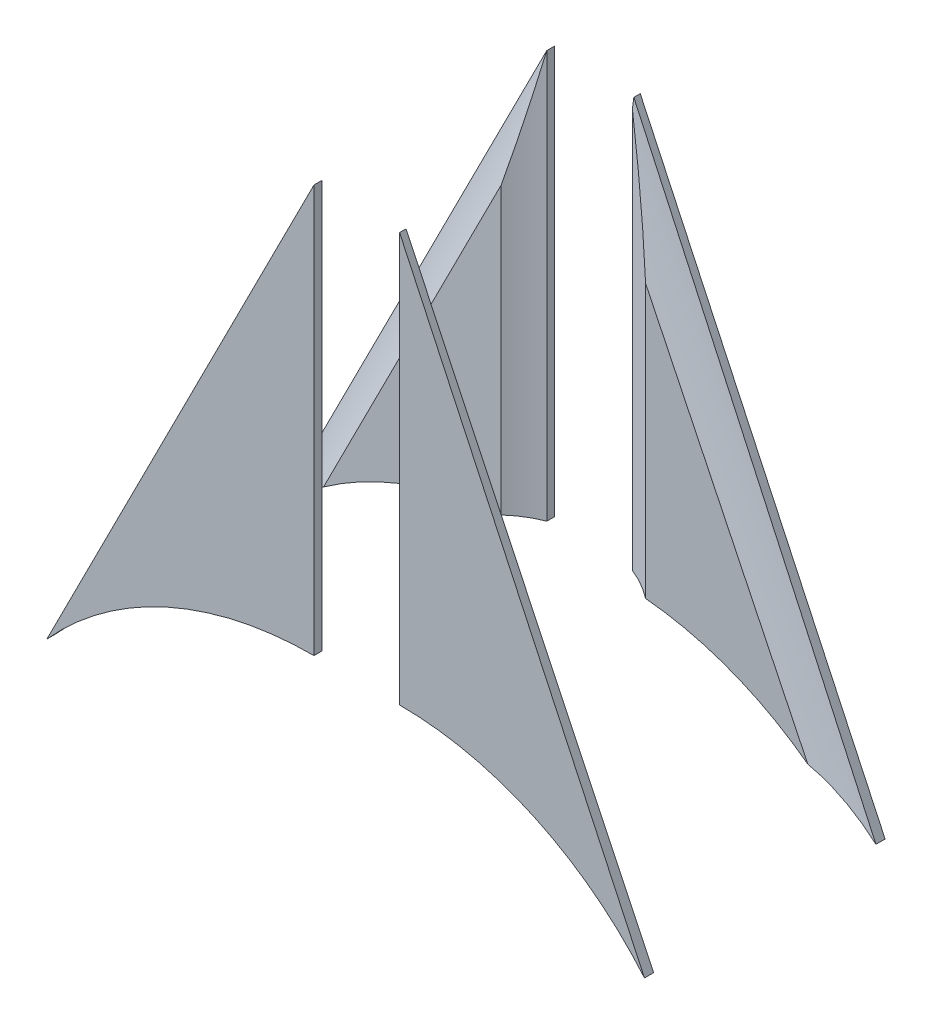
from build123d import *

# Parameters (mm, degrees)
BOSS_EXTRUDE1_DEPTH   = 1.5875
BOSS_EXTRUDE1_2_DEPTH = 1.5875
CUT_SWEEP1_PROFILE_R  = 7.9375
CUT_SWEEP2_START      = -23.066232356
CUT_SWEEP2_DEPTH      = 38.09827597
CUT_SWEEP3_PROFILE_R  = 7.9375


# Read off the part's stored shape, not the designer's step: Cut-Sweep2
with BuildPart() as part:
    # Sketch3 → Boss-Extrude1 (new body)
    with BuildSketch(Plane.XY.offset(6.35)):
        with BuildLine():
            Line((-20.444314967, -7.866681121), (-2.822222222, 26.887811152))
            Line((-2.822222222, 26.887811152), (-2.822222222, 0))
            ThreePointArc((-2.822222222, 0), (-12.471352035, -2.055956199), (-20.444314967, -7.866681121))
        make_face()
    extrude(amount=BOSS_EXTRUDE1_DEPTH)


with BuildPart() as body_2:
    # Sketch3 → Boss-Extrude1 2 (new body)
    with BuildSketch(Plane.XY.offset(6.35)):
        with BuildLine():
            Line((2.822222222, 0), (2.822222222, 26.989428429))
            Line((2.822222222, 26.989428429), (18.976219439, -7.518023406))
            ThreePointArc((18.976219439, -7.518023406), (11.731098442, -1.97155403), (2.822222222, 0))
        make_face()
    extrude(amount=BOSS_EXTRUDE1_2_DEPTH)


with BuildPart() as body_3:
    # Mirror1: mirrored copy
    add(body_2.part.mirror(Plane.XY))


with BuildPart() as body_4:
    # Mirror1 2: mirrored copy
    add(part.part.mirror(Plane.XY))


with BuildPart() as cut_sweep1_tool:
    # Cut-Sweep1: sweep along a path in Sketch4
    with BuildLine(Plane.XY) as cut_sweep1_path:
        Line((0, 86.299042294), (0, -191.883729254))
    # Cut-Sweep1 profile (on start of the path) → Cut-Sweep1 (sweep)
    with BuildSketch(Plane(origin=(0, 86.299042294, 0), x_dir=(-1, 0, 0), z_dir=(0, -1, 0))):
        Circle(CUT_SWEEP1_PROFILE_R)
    sweep(path=cut_sweep1_path.line)


with BuildPart() as part_1:
    add(part.part)

    # Cut-Sweep1: cut by cut_sweep1_tool
    add(cut_sweep1_tool.part, mode=Mode.SUBTRACT)


with BuildPart() as body_2_1:
    add(body_2.part)

    # Cut-Sweep1: cut by cut_sweep1_tool
    add(cut_sweep1_tool.part, mode=Mode.SUBTRACT)


with BuildPart() as body_3_1:
    add(body_3.part)

    # Cut-Sweep1: cut by cut_sweep1_tool
    add(cut_sweep1_tool.part, mode=Mode.SUBTRACT)


with BuildPart() as body_4_1:
    add(body_4.part)

    # Cut-Sweep1: cut by cut_sweep1_tool
    add(cut_sweep1_tool.part, mode=Mode.SUBTRACT)


with BuildPart() as cut_sweep2_tool:
    # Cut-Sweep2 outline → Cut-Sweep2 (new body)
    with BuildSketch(Plane(origin=(0, 0, 0), x_dir=(0.900180526385369, 0.435516957094164, 0), z_dir=(0.435516957094164, -0.900180526385369, 0)).offset(CUT_SWEEP2_START)):
        with BuildLine():
            ThreePointArc((12.089594916, -6.35), (13.146220171, -7.019287615), (14.294863229, -7.514284553))
            Line((14.294863229, -7.514284553), (16, -8.094569974))
            Line((16, -8.094569974), (16, -6.35))
            Line((16, -6.35), (12.089594916, -6.35))
        make_face()
        with BuildLine():
            Line((12.089594916, 6.35), (16, 6.35))
            Line((16, 6.35), (16, 8.094569974))
            Line((16, 8.094569974), (14.294863229, 7.514284553))
            ThreePointArc((14.294863229, 7.514284553), (13.146220171, 7.019287615), (12.089594916, 6.35))
        make_face()
    extrude(amount=CUT_SWEEP2_DEPTH)


with BuildPart() as body_2_2:
    add(body_2_1.part)

    # Cut-Sweep2: cut by cut_sweep2_tool
    add(cut_sweep2_tool.part, mode=Mode.SUBTRACT)


with BuildPart() as body_3_2:
    add(body_3_1.part)

    # Cut-Sweep2: cut by cut_sweep2_tool
    add(cut_sweep2_tool.part, mode=Mode.SUBTRACT)


with BuildPart() as cut_sweep3_tool:
    # Cut-Sweep3: sweep along a path in Sketch4<12>
    with BuildLine(Plane.XY) as cut_sweep3_path:
        Line((0, 38.694463308), (-114.172049028, -186.476953797))
    # Cut-Sweep3 profile (on start of the path) → Cut-Sweep3 (sweep)
    with BuildSketch(Plane(origin=(0, 38.694463308, 0), x_dir=(-0.8918996796843264, 0.45223330414620744, 0), z_dir=(-0.45223330414620744, -0.8918996796843264, 0))):
        Circle(CUT_SWEEP3_PROFILE_R)
    sweep(path=cut_sweep3_path.line)


with BuildPart() as part_2:
    add(part_1.part)

    # Cut-Sweep3: cut by cut_sweep3_tool
    add(cut_sweep3_tool.part, mode=Mode.SUBTRACT)


with BuildPart() as body_4_2:
    add(body_4_1.part)

    # Cut-Sweep3: cut by cut_sweep3_tool
    add(cut_sweep3_tool.part, mode=Mode.SUBTRACT)


solid = Compound([body_2_2.part, body_3_2.part, part_2.part, body_4_2.part])
